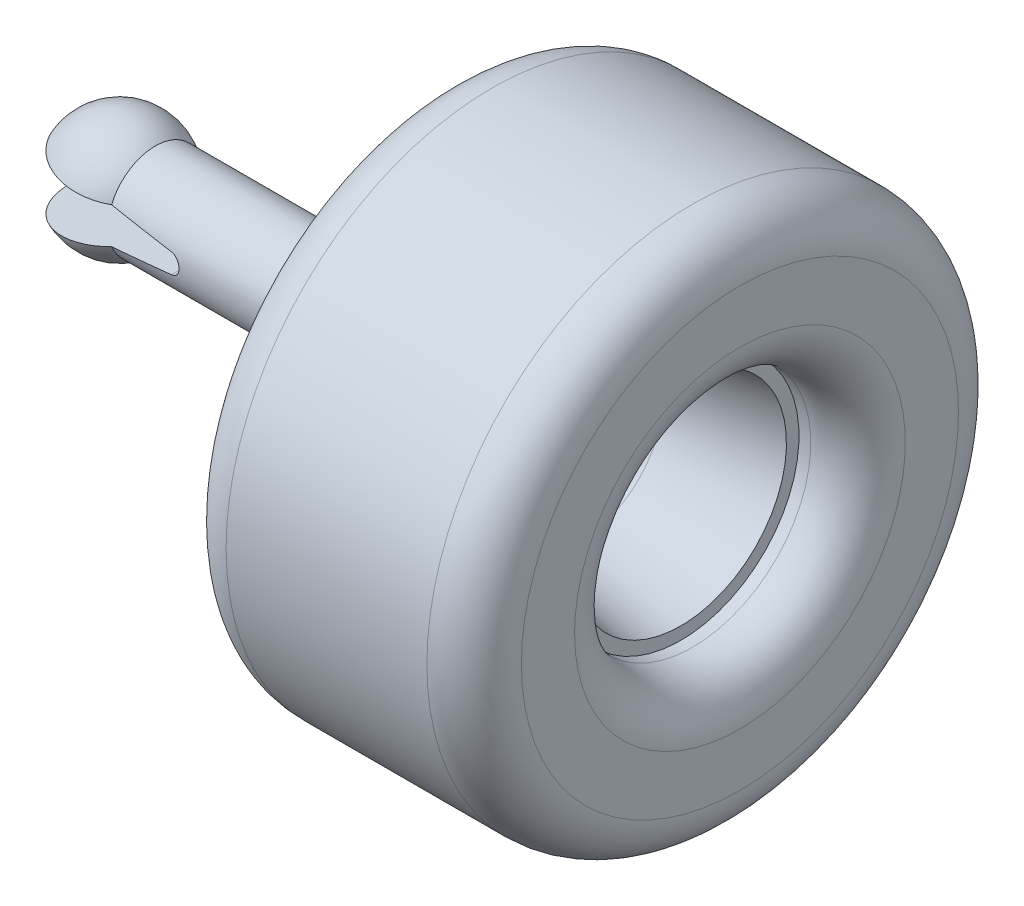
from build123d import *

# Parameters (mm, degrees)
CUT_EXTRUDE_1_DEPTH      = 123.780291578
CUT_EXTRUDE_1_DEPTH_BACK = 123.780291578


with BuildPart() as part:
    # 草圖1 → 旋轉1 (revolve)
    with BuildSketch(Plane.XY):
        with BuildLine():
            Line((6, 8), (49, 8))
            ThreePointArc((49, 8), (53.242640687, 9.757359313), (55, 14))
            Line((55, 14), (55, 37))
            ThreePointArc((55, 37), (57.343145751, 42.656854249), (63, 45))
            Line((63, 45), (97, 45))
            ThreePointArc((97, 45), (102.656854249, 42.656854249), (105, 37))
            Line((105, 37), (105, 28))
            ThreePointArc((105, 28), (102.656854249, 22.343145751), (97, 20))
            Line((97, 20), (95, 20))
            Line((95, 20), (95, 17.876303889))
            Line((95, 17.876303889), (77.395277335, 14.772116295))
            ThreePointArc((77.395277335, 14.772116295), (70.625310141, 11.709619552), (66.155739431, 5.773772537))
            Line((66.155739431, 5.773772537), (75, 5))
            Line((75, 5), (75, 0))
            Line((75, 0), (-10, 0))
            ThreePointArc((-10, 0), (-4.472135955, 8.94427191), (6, 8))
        make_face()
    revolve(axis=Axis((0, 0, 0), (1, 0, 0)))

    # 草圖2 → 除料-伸長1 (cut, two sides: drawn at the far end of the back side and taken through both)
    with BuildSketch(Plane.XY.offset(-CUT_EXTRUDE_1_DEPTH_BACK)):
        with BuildLine():
            Line((-264.793827917, 38.720624717), (-8.660254038, 5))
            Line((-8.660254038, 5), (16.560866404, 1.679576502))
            ThreePointArc((16.560866404, 1.679576502), (18.033815464, 0), (16.560866404, -1.679576502))
            Line((16.560866404, -1.679576502), (-8.660254038, -5))
            Line((-8.660254038, -5), (-264.793827917, -38.720624717))
            Line((-264.793827917, -38.720624717), (-781.481308701, -38.720624717))
            Line((-781.481308701, -38.720624717), (-781.481308701, 38.720624717))
            Line((-781.481308701, 38.720624717), (-264.793827917, 38.720624717))
        make_face()
    extrude(amount=CUT_EXTRUDE_1_DEPTH + CUT_EXTRUDE_1_DEPTH_BACK, mode=Mode.SUBTRACT)


solid = part.part
